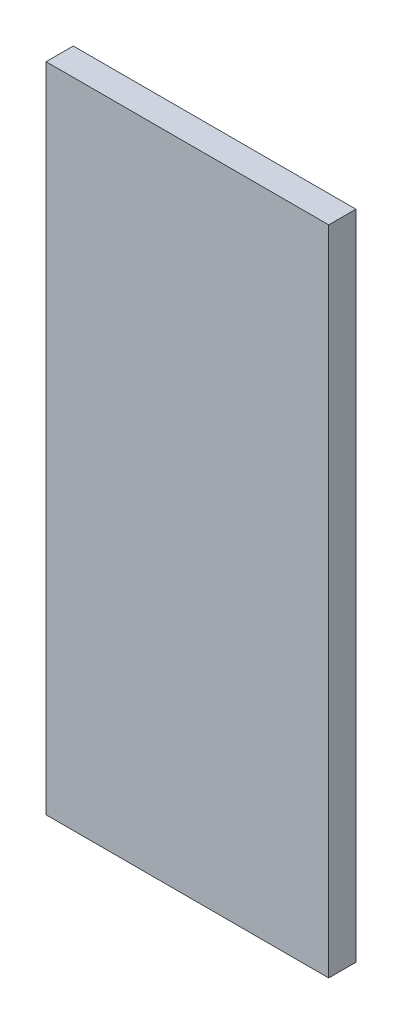
from build123d import *

# Parameters (mm, degrees)
SKETCH1_W           = 66.04
SKETCH1_H           = 152.4
BOSS_EXTRUDE1_DEPTH = 6.35


with BuildPart() as part:
    # Sketch1 → Boss-Extrude1 (new body)
    with BuildSketch(Plane.XY):
        with Locations((-1.655434196, 35.459021407)):
            Rectangle(SKETCH1_W, SKETCH1_H)
    extrude(amount=BOSS_EXTRUDE1_DEPTH)


solid = part.part
